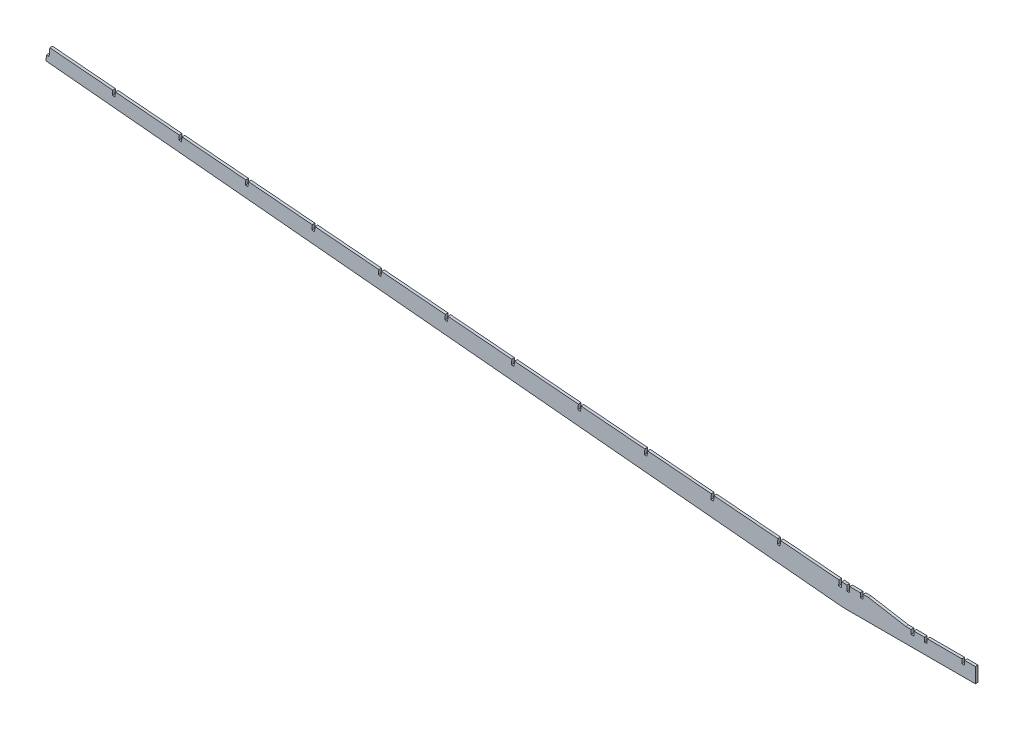
from build123d import *

# Parameters (mm, degrees)
BOSS_EXTRUDE1_DEPTH = 3.175
CUT_EXTRUDE1_DEPTH  = 955.350997373


with BuildPart() as part:
    # Sketch1 → Boss-Extrude1 (new body)
    with BuildSketch(Plane.XY):
        Polygon((-950.530495659, 69.619322302), (-951.061849964, 63.291592645), (-11.536706102, -24.902638492), (-8.372841274, -25.168315645), (0, -25.545856054), (152.4, -25.545856054), (152.4, -7.765856054), (139.7, -7.765856054), (139.7, -12.845856054), (136.525, -12.845856054), (136.525, -7.765856054), (95.25, -7.765856054), (95.25, -12.845856054), (92.075, -12.845856054), (92.075, -7.765856054), (79.375, -7.765856054), (79.375, -12.845856054), (76.2, -12.845856054), (76.2, -7.765856054), (69.85, -7.765856054), (25.4, -0.145856054), (19.05, -0.145856054), (19.05, -5.225856054), (15.875, -5.225856054), (15.875, -0.145856054), (3.175, -0.145856054), (3.175, -6.495856054), (0, -6.495856054), (0, -0.145856054), (-2.81225704, -0.145856054), (-6.247424053, 0.14260298), (-6.778778359, -6.185126677), (-9.942643187, -5.919449524), (-9.411288881, 0.408280132), (-946.54805097, 79.101852726), (-947.366630831, 69.353645149), align=None)
    extrude(amount=BOSS_EXTRUDE1_DEPTH)

    # Sketch2 → Cut-Extrude1 (cut, through all)
    with BuildSketch(Plane.XY.offset(3.175)):
        Polygon((-79.415081651, -0.013332249), (-78.889760507, 6.242550403), (-82.053625335, 6.508227555), (-82.578671745, 0.255616625), align=None)
        Polygon((-158.378290396, 6.699631648), (-157.859826617, 12.873852131), (-161.023691445, 13.139529284), (-161.54188049, 6.968580522), align=None)
        Polygon((-237.341499142, 13.412595546), (-236.829892727, 19.50515386), (-239.993757555, 19.770831012), (-240.505089236, 13.68154442), align=None)
        Polygon((-316.304707888, 20.125559443), (-315.799958836, 26.136455588), (-318.963823664, 26.402132741), (-319.468297982, 20.394508317), align=None)
        Polygon((-395.267916634, 26.83852334), (-394.770024946, 32.767757316), (-397.933889774, 33.033434469), (-398.431506728, 27.107472214), align=None)
        Polygon((-474.23112538, 33.551487238), (-473.740091056, 39.399059045), (-476.903955884, 39.664736197), (-477.394715474, 33.820436112), align=None)
        Polygon((-553.194334126, 40.264451135), (-552.710157166, 46.030360773), (-555.874021994, 46.296037926), (-556.35792422, 40.533400009), align=None)
        Polygon((-632.157542872, 46.977415032), (-631.680223276, 52.661662502), (-634.844088104, 52.927339654), (-635.321132966, 47.246363906), align=None)
        Polygon((-711.120751618, 53.69037893), (-710.650289385, 59.29296423), (-713.814154213, 59.558641383), (-714.284341712, 53.959327804), align=None)
        Polygon((-790.083960364, 60.403342827), (-789.620355495, 65.924265958), (-792.784220323, 66.189943111), (-793.247550458, 60.672291701), align=None)
        Polygon((-869.047169109, 67.116306724), (-868.590421605, 72.555567687), (-871.754286433, 72.821244839), (-872.210759203, 67.385255598), align=None)
    extrude(amount=-CUT_EXTRUDE1_DEPTH, mode=Mode.SUBTRACT)


solid = part.part
